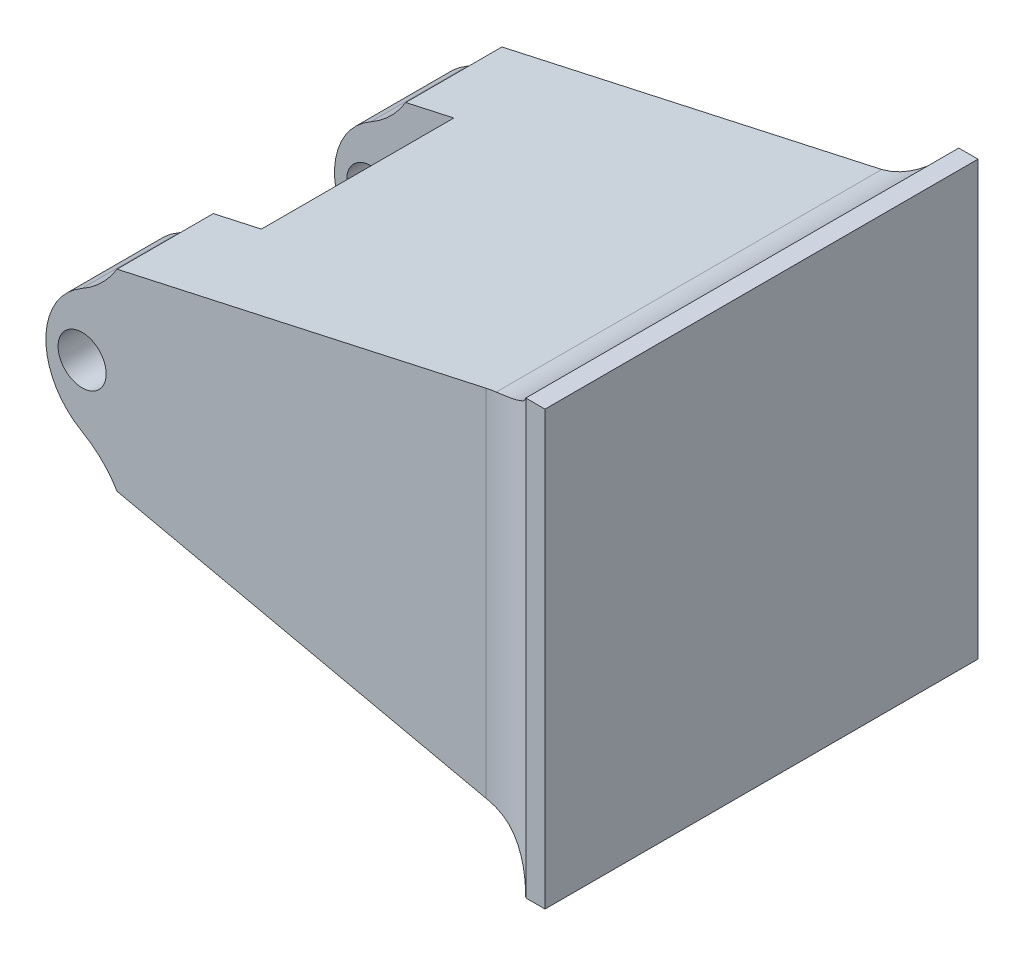
from build123d import *

# Parameters (mm, degrees)
BOSS_EXTRUDE1_DEPTH      = 20
BOSS_EXTRUDE1_DEPTH_BACK = 20
SKETCH2_W                = 45
SKETCH2_H                = 45
BOSS_EXTRUDE2_DEPTH      = 2
SKETCH3_R                = 2.5
BOSS_EXTRUDE3_DEPTH      = 10
FILLET1_R                = 10
FILLET2_R                = 10
FILLET1_OF_MIRROR1_R     = 10
CUT_EXTRUDE1_DEPTH       = 5


with BuildPart() as part:
    # Sketch1 → Boss-Extrude1 (new, two sides: drawn at the far end of the back side and taken through both)
    with BuildSketch(Plane.XY.offset(-BOSS_EXTRUDE1_DEPTH_BACK)):
        Polygon((0, 0), (45.339322565, -10), (45.339322565, 30), (0, 20), align=None)
    extrude(amount=BOSS_EXTRUDE1_DEPTH + BOSS_EXTRUDE1_DEPTH_BACK)

    # Sketch2 → Boss-Extrude2 (add)
    with BuildSketch(Plane(origin=(45.339322565, 0, 0), x_dir=(0, 0, -1), z_dir=(1, 0, 0))):
        with Locations((-0.360618032, 10)):
            Rectangle(SKETCH2_W, SKETCH2_H)
    extrude(amount=BOSS_EXTRUDE2_DEPTH)

    # Sketch3 → Boss-Extrude3 (add)
    with BuildSketch(Plane.XY.offset(20)):
        with BuildLine():
            Line((0, 17.400398526), (0, 2.599601474))
            ThreePointArc((0, 2.599601474), (-7.400398526, 10), (0, 17.400398526))
        make_face()
        with Locations((-3.63186502, 10)):
            Circle(SKETCH3_R, mode=Mode.SUBTRACT)
    boss_extrude3 = extrude(amount=-BOSS_EXTRUDE3_DEPTH)

    # Fillet1
    # the kernel refuses this fillet: 10 mm, written as the material it adds along each edge
    with BuildSketch(Plane(origin=(0, 17.400398526, 20), x_dir=(0, 1, 0), z_dir=(0, 0, -1))) as fillet1_piece_1:
        with BuildLine():
            CenterArc((7.738294917, -8.578684614), FILLET1_R, 120.92191029, 29.539044855)
            Line((-0.961904346, -3.64851902), (-1.135908331, -3.549915708))
            ThreePointArc((-1.135908331, -3.549915708), (-0.437907417, -1.835607933), (-0.2, 0))
            Line((-0.2, 0), (0, 0.2))
            ThreePointArc((0, 0.2), (1.299800737, 0.2), (2.496827605, 0.171573692))
            Line((2.496827605, 0.171573692), (2.599601474, 0))
        make_face()
    extrude(amount=10)
    with BuildSketch(Plane(origin=(0, 2.599601474, 20), x_dir=(0, -1, 0), z_dir=(0, 0, -1))) as fillet1_piece_2:
        with BuildLine():
            CenterArc((7.738294917, 8.578684614), FILLET1_R, 209.539044855, 29.539044855)
            Line((-0.961904346, 3.64851902), (-1.135908331, 3.549915708))
            ThreePointArc((-1.135908331, 3.549915708), (-0.437907417, 1.835607933), (-0.2, 0))
            Line((-0.2, 0), (0, -0.2))
            ThreePointArc((0, -0.2), (1.299800737, -0.2), (2.496827605, -0.171573692))
            Line((2.496827605, -0.171573692), (2.599601474, 0))
        make_face()
    extrude(amount=10)

    # Fillet2
    # the kernel refuses this fillet: 10 mm, written as the material it adds along each edge
    with BuildSketch(Plane(origin=(45.339322565, -25.45369781, -20), x_dir=(0, 0, -1), z_dir=(0, 1, 0))) as fillet2_piece_1_section:
        with BuildLine():
            CenterArc((10, 6.181479124), FILLET2_R, 180, 38.181011009)
            Line((0, 6.181479124), (-0.2, 6.181479124))
            Line((-0.2, 6.181479124), (-0.2, 0))
            Line((-0.2, 0), (0, -0.2))
            ThreePointArc((0, -0.2), (1.069690984, -0.2), (1.982169608, -0.123629582))
            Line((1.982169608, -0.123629582), (2.139381968, 0))
        make_face()
    fillet2_piece_1 = extrude(amount=70.907395619, mode=Mode.PRIVATE)
    fillet2_piece_1 = split(fillet2_piece_1, bisect_by=Plane(origin=(39.504780755, 28.713138732, -20.498392339), z_dir=(0.21538252084274712, -0.9765297587454381, 0)), keep=Keep.TOP, mode=Mode.PRIVATE)
    fillet2_piece_1 = split(fillet2_piece_1, bisect_by=Plane(origin=(39.504780755, -8.713138732, -20.498392339), z_dir=(0.21538252084274712, 0.9765297587454381, 0)), keep=Keep.TOP, mode=Mode.PRIVATE)
    add(fillet2_piece_1)
    with BuildSketch(Plane(origin=(45.339322565, -27.505217992, 20), x_dir=(0, 0, 1), z_dir=(0, 1, 0))) as fillet2_piece_2_section:
        with BuildLine():
            CenterArc((10, -7.002087197), FILLET2_R, 135.556247991, 44.443752009)
            Line((0, -7.002087197), (-0.2, -7.002087197))
            Line((-0.2, -7.002087197), (-0.2, 0))
            Line((-0.2, 0), (0, 0.2))
            ThreePointArc((0, 0.2), (1.430309016, 0.2), (2.717830392, 0.140041744))
            Line((2.717830392, 0.140041744), (2.860618032, 0))
        make_face()
    fillet2_piece_2 = extrude(amount=75.010435984, mode=Mode.PRIVATE)
    fillet2_piece_2 = split(fillet2_piece_2, bisect_by=Plane(origin=(39.36542439, 28.682402419, 20.709590356), z_dir=(0.21538252084274712, -0.9765297587454381, 0)), keep=Keep.TOP, mode=Mode.PRIVATE)
    fillet2_piece_2 = split(fillet2_piece_2, bisect_by=Plane(origin=(39.36542439, -8.682402419, 20.709590356), z_dir=(0.21538252084274712, 0.9765297587454381, 0)), keep=Keep.TOP, mode=Mode.PRIVATE)
    add(fillet2_piece_2)
    with BuildSketch(Plane(origin=(45.339322565, -10, -20), x_dir=(0, -1, 0), z_dir=(0, 0, 1))) as fillet2_piece_3:
        with BuildLine():
            CenterArc((8.471109431, -8.021586636), FILLET2_R, 126.663263197, 40.898766881)
            Line((-1.294188156, -5.867761428), (-1.489494108, -5.824684924))
            Line((-1.489494108, -5.824684924), (-0.195305952, 0.043076504))
            Line((-0.195305952, 0.043076504), (0, 0.2))
            ThreePointArc((0, 0.2), (1.25, 0.2), (2.380577811, 0.160431733))
            Line((2.380577811, 0.160431733), (2.5, 0))
        make_face()
    extrude(amount=40)
    with BuildSketch(Plane(origin=(45.339322565, 30, -20), x_dir=(-0.9765297587454381, -0.2153825208427468, 0), z_dir=(0, 0, 1))) as fillet2_piece_4:
        with BuildLine():
            CenterArc((6.008789159, -10), FILLET2_R, 90, 40.898766881)
            Line((-0.538456302, -2.441324397), (-0.669401211, -2.290150885))
            ThreePointArc((-0.669401211, -2.290150885), (-0.464534103, -1.177585694), (-0.195305952, 0.043076504))
            Line((-0.195305952, 0.043076504), (0, 0.2))
            Line((0, 0.2), (6.008789159, 0.2))
            Line((6.008789159, 0.2), (6.008789159, 0))
        make_face()
    extrude(amount=40)
    with BuildSketch(Plane(origin=(45.339322565, -10, -35.021972897), x_dir=(0, -1, 0), z_dir=(0, 0, 1))) as fillet2_piece_5a_section:
        with BuildLine():
            CenterArc((8.471109431, -8.021586636), FILLET2_R, 126.663263197, 40.898766881)
            Line((-1.294188156, -5.867761428), (-1.489494108, -5.824684924))
            Line((-1.489494108, -5.824684924), (-0.195305952, 0.043076504))
            Line((-0.195305952, 0.043076504), (0, 0.2))
            ThreePointArc((0, 0.2), (1.25, 0.2), (2.380577811, 0.160431733))
            Line((2.380577811, 0.160431733), (2.5, 0))
        make_face()
    fillet2_piece_5a = extrude(amount=55.021972897, mode=Mode.PRIVATE)
    fillet2_piece_5a = split(fillet2_piece_5a, bisect_by=Plane(origin=(43.769128199, -10.239106688, -22.139381968), z_dir=(0, 0, 1)), keep=Keep.TOP, mode=Mode.PRIVATE)
    fillet2_piece_5a = split(fillet2_piece_5a, bisect_by=Plane(origin=(43.769128199, -10.239106688, -20), z_dir=(0, 0, -1)), keep=Keep.TOP, mode=Mode.PRIVATE)
    with BuildSketch(Plane(origin=(45.339322565, -25.45369781, -20), x_dir=(0, 0, -1), z_dir=(0, 1, 0))) as fillet2_piece_5b_section:
        with BuildLine():
            CenterArc((10, 6.181479124), FILLET2_R, 180, 38.181011009)
            Line((0, 6.181479124), (-0.2, 6.181479124))
            Line((-0.2, 6.181479124), (-0.2, 0))
            Line((-0.2, 0), (0, -0.2))
            ThreePointArc((0, -0.2), (1.069690984, -0.2), (1.982169608, -0.123629582))
            Line((1.982169608, -0.123629582), (2.139381968, 0))
        make_face()
    fillet2_piece_5b = extrude(amount=70.907395619, mode=Mode.PRIVATE)
    fillet2_piece_5b = split(fillet2_piece_5b, bisect_by=Plane(origin=(43.426536719, -12.5, -20.45631317), z_dir=(0, 1, 0)), keep=Keep.TOP, mode=Mode.PRIVATE)
    fillet2_piece_5b = split(fillet2_piece_5b, bisect_by=Plane(origin=(43.733812734, -9.645890203, -20.45631317), z_dir=(-0.21538252084274712, -0.9765297587454381, 0)), keep=Keep.TOP, mode=Mode.PRIVATE)
    fillet2_piece_5 = fillet2_piece_5a & fillet2_piece_5b
    add(fillet2_piece_5)
    with BuildSketch(Plane(origin=(45.339322565, 30, -35.021972897), x_dir=(-0.9765297587454381, -0.2153825208427468, 0), z_dir=(0, 0, 1))) as fillet2_piece_6a_section:
        with BuildLine():
            CenterArc((6.008789159, -10), FILLET2_R, 90, 40.898766881)
            Line((-0.538456302, -2.441324397), (-0.669401211, -2.290150885))
            ThreePointArc((-0.669401211, -2.290150885), (-0.464534103, -1.177585694), (-0.195305952, 0.043076504))
            Line((-0.195305952, 0.043076504), (0, 0.2))
            Line((0, 0.2), (6.008789159, 0.2))
            Line((6.008789159, 0.2), (6.008789159, 0))
        make_face()
    fillet2_piece_6a = extrude(amount=55.021972897, mode=Mode.PRIVATE)
    fillet2_piece_6a = split(fillet2_piece_6a, bisect_by=Plane(origin=(43.769128199, 30.239106688, -20), z_dir=(0, 0, -1)), keep=Keep.TOP, mode=Mode.PRIVATE)
    fillet2_piece_6a = split(fillet2_piece_6a, bisect_by=Plane(origin=(43.769128199, 30.239106688, -22.139381968), z_dir=(0, 0, 1)), keep=Keep.TOP, mode=Mode.PRIVATE)
    with BuildSketch(Plane(origin=(45.339322565, -25.45369781, -20), x_dir=(0, 0, -1), z_dir=(0, 1, 0))) as fillet2_piece_6b_section:
        with BuildLine():
            CenterArc((10, 6.181479124), FILLET2_R, 180, 38.181011009)
            Line((0, 6.181479124), (-0.2, 6.181479124))
            Line((-0.2, 6.181479124), (-0.2, 0))
            Line((-0.2, 0), (0, -0.2))
            ThreePointArc((0, -0.2), (1.069690984, -0.2), (1.982169608, -0.123629582))
            Line((1.982169608, -0.123629582), (2.139381968, 0))
        make_face()
    fillet2_piece_6b = extrude(amount=70.907395619, mode=Mode.PRIVATE)
    fillet2_piece_6b = split(fillet2_piece_6b, bisect_by=Plane(origin=(43.733812734, 29.645890203, -20.45631317), z_dir=(-0.21538252084274712, 0.9765297587454381, 0)), keep=Keep.TOP, mode=Mode.PRIVATE)
    fillet2_piece_6b = split(fillet2_piece_6b, bisect_by=Plane(origin=(43.426536719, 32.5, -20.45631317), z_dir=(0, -1, 0)), keep=Keep.TOP, mode=Mode.PRIVATE)
    fillet2_piece_6 = fillet2_piece_6a & fillet2_piece_6b
    add(fillet2_piece_6)
    with BuildSketch(Plane(origin=(45.339322565, -10, -20), x_dir=(0, -1, 0), z_dir=(0, 0, 1))) as fillet2_piece_7a_section:
        with BuildLine():
            CenterArc((8.471109431, -8.021586636), FILLET2_R, 126.663263197, 40.898766881)
            Line((-1.294188156, -5.867761428), (-1.489494108, -5.824684924))
            Line((-1.489494108, -5.824684924), (-0.195305952, 0.043076504))
            Line((-0.195305952, 0.043076504), (0, 0.2))
            ThreePointArc((0, 0.2), (1.25, 0.2), (2.380577811, 0.160431733))
            Line((2.380577811, 0.160431733), (2.5, 0))
        make_face()
    fillet2_piece_7a = extrude(amount=55.021972897, mode=Mode.PRIVATE)
    fillet2_piece_7a = split(fillet2_piece_7a, bisect_by=Plane(origin=(43.769128199, -10.239106688, 22.860618032), z_dir=(0, 0, -1)), keep=Keep.TOP, mode=Mode.PRIVATE)
    fillet2_piece_7a = split(fillet2_piece_7a, bisect_by=Plane(origin=(43.769128199, -10.239106688, 20), z_dir=(0, 0, 1)), keep=Keep.TOP, mode=Mode.PRIVATE)
    with BuildSketch(Plane(origin=(45.339322565, -27.505217992, 20), x_dir=(0, 0, 1), z_dir=(0, 1, 0))) as fillet2_piece_7b_section:
        with BuildLine():
            CenterArc((10, -7.002087197), FILLET2_R, 135.556247991, 44.443752009)
            Line((0, -7.002087197), (-0.2, -7.002087197))
            Line((-0.2, -7.002087197), (-0.2, 0))
            Line((-0.2, 0), (0, 0.2))
            ThreePointArc((0, 0.2), (1.430309016, 0.2), (2.717830392, 0.140041744))
            Line((2.717830392, 0.140041744), (2.860618032, 0))
        make_face()
    fillet2_piece_7b = extrude(amount=75.010435984, mode=Mode.PRIVATE)
    fillet2_piece_7b = split(fillet2_piece_7b, bisect_by=Plane(origin=(43.242503202, -12.5, 20.649437077), z_dir=(0, 1, 0)), keep=Keep.TOP, mode=Mode.PRIVATE)
    fillet2_piece_7b = split(fillet2_piece_7b, bisect_by=Plane(origin=(43.554047841, -9.606241421, 20.649437077), z_dir=(-0.21538252084274712, -0.9765297587454381, 0)), keep=Keep.TOP, mode=Mode.PRIVATE)
    fillet2_piece_7 = fillet2_piece_7a & fillet2_piece_7b
    add(fillet2_piece_7)
    with BuildSketch(Plane(origin=(45.339322565, 30, -20), x_dir=(-0.9765297587454381, -0.2153825208427468, 0), z_dir=(0, 0, 1))) as fillet2_piece_8a_section:
        with BuildLine():
            CenterArc((6.008789159, -10), FILLET2_R, 90, 40.898766881)
            Line((-0.538456302, -2.441324397), (-0.669401211, -2.290150885))
            ThreePointArc((-0.669401211, -2.290150885), (-0.464534103, -1.177585694), (-0.195305952, 0.043076504))
            Line((-0.195305952, 0.043076504), (0, 0.2))
            Line((0, 0.2), (6.008789159, 0.2))
            Line((6.008789159, 0.2), (6.008789159, 0))
        make_face()
    fillet2_piece_8a = extrude(amount=55.021972897, mode=Mode.PRIVATE)
    fillet2_piece_8a = split(fillet2_piece_8a, bisect_by=Plane(origin=(43.769128199, 30.239106688, 20), z_dir=(0, 0, 1)), keep=Keep.TOP, mode=Mode.PRIVATE)
    fillet2_piece_8a = split(fillet2_piece_8a, bisect_by=Plane(origin=(43.769128199, 30.239106688, 22.860618032), z_dir=(0, 0, -1)), keep=Keep.TOP, mode=Mode.PRIVATE)
    with BuildSketch(Plane(origin=(45.339322565, -27.505217992, 20), x_dir=(0, 0, 1), z_dir=(0, 1, 0))) as fillet2_piece_8b_section:
        with BuildLine():
            CenterArc((10, -7.002087197), FILLET2_R, 135.556247991, 44.443752009)
            Line((0, -7.002087197), (-0.2, -7.002087197))
            Line((-0.2, -7.002087197), (-0.2, 0))
            Line((-0.2, 0), (0, 0.2))
            ThreePointArc((0, 0.2), (1.430309016, 0.2), (2.717830392, 0.140041744))
            Line((2.717830392, 0.140041744), (2.860618032, 0))
        make_face()
    fillet2_piece_8b = extrude(amount=75.010435984, mode=Mode.PRIVATE)
    fillet2_piece_8b = split(fillet2_piece_8b, bisect_by=Plane(origin=(43.554047841, 29.606241421, 20.649437077), z_dir=(-0.21538252084274712, 0.9765297587454381, 0)), keep=Keep.TOP, mode=Mode.PRIVATE)
    fillet2_piece_8b = split(fillet2_piece_8b, bisect_by=Plane(origin=(43.242503202, 32.5, 20.649437077), z_dir=(0, -1, 0)), keep=Keep.TOP, mode=Mode.PRIVATE)
    fillet2_piece_8 = fillet2_piece_8a & fillet2_piece_8b
    add(fillet2_piece_8)

    # Mirror1: Boss-Extrude3 across plane
    add(boss_extrude3.mirror(Plane.XY))

    # Fillet1 of Mirror1
    # the kernel refuses this fillet: 10 mm, written as the material it adds along each edge
    with BuildSketch(Plane(origin=(0, 17.400398526, -20), x_dir=(0, 1, 0), z_dir=(0, 0, 1))) as fillet1_of_mirror1_piece_1:
        with BuildLine():
            CenterArc((7.738294917, 8.578684614), FILLET1_OF_MIRROR1_R, 209.539044855, 29.539044855)
            Line((-0.961904346, 3.64851902), (-1.135908331, 3.549915708))
            ThreePointArc((-1.135908331, 3.549915708), (-0.437907417, 1.835607933), (-0.2, 0))
            Line((-0.2, 0), (0, -0.2))
            ThreePointArc((0, -0.2), (1.299800737, -0.2), (2.496827605, -0.171573692))
            Line((2.496827605, -0.171573692), (2.599601474, 0))
        make_face()
    extrude(amount=10)
    with BuildSketch(Plane(origin=(0, 2.599601474, -20), x_dir=(0, -1, 0), z_dir=(0, 0, 1))) as fillet1_of_mirror1_piece_2:
        with BuildLine():
            CenterArc((7.738294917, -8.578684614), FILLET1_OF_MIRROR1_R, 120.92191029, 29.539044855)
            Line((-0.961904346, -3.64851902), (-1.135908331, -3.549915708))
            ThreePointArc((-1.135908331, -3.549915708), (-0.437907417, -1.835607933), (-0.2, 0))
            Line((-0.2, 0), (0, 0.2))
            ThreePointArc((0, 0.2), (1.299800737, 0.2), (2.496827605, 0.171573692))
            Line((2.496827605, 0.171573692), (2.599601474, 0))
        make_face()
    extrude(amount=10)

    # Sketch4 → Cut-Extrude1 (cut)
    with BuildSketch(Plane.ZY):
        Polygon((-10, 20), (-10, 23.785509991), (10, 23.785509991), (10, 20), (10, 0), (10, -3.785509991), (-10, -3.785509991), (-10, 0), align=None)
    extrude(amount=-CUT_EXTRUDE1_DEPTH, mode=Mode.SUBTRACT)


solid = part.part
